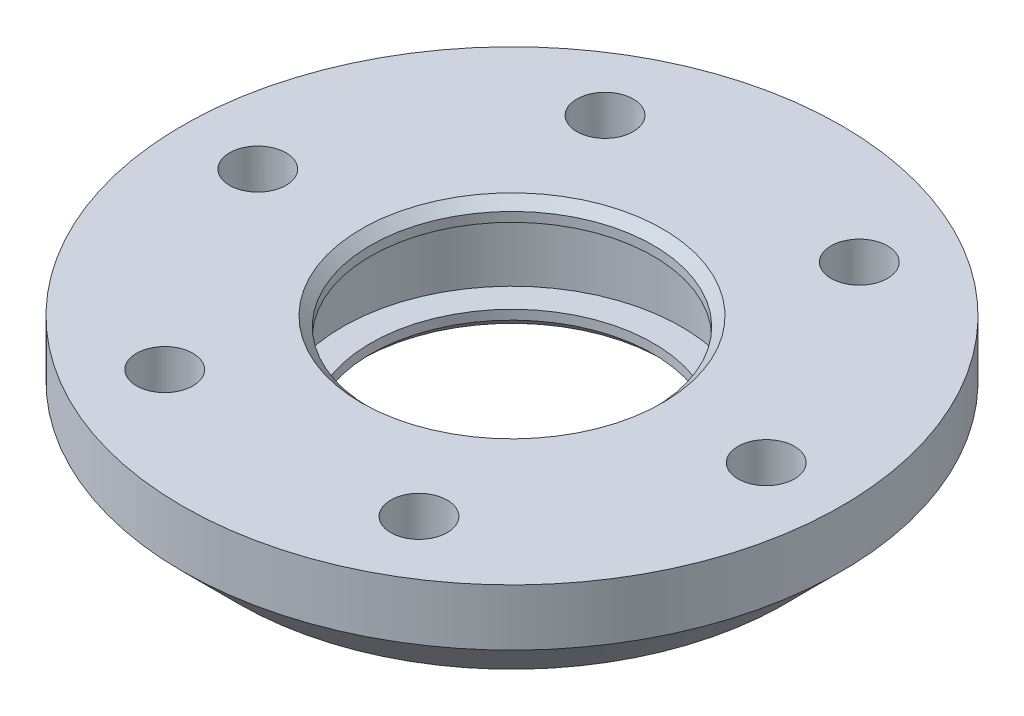
from build123d import *

# Parameters (mm, degrees)
SKETCH1_R           = 17.5
SKETCH1_R_2         = 1.5
SKETCH1_R_3         = 7.5
BOSS_EXTRUDE1_DEPTH = 3
SKETCH2_R           = 9
CUT_EXTRUDE1_DEPTH  = 2
SKETCH3_R           = 15
SKETCH3_R_2         = 12
BOSS_EXTRUDE2_DEPTH = 1.5
CHAMFER1_SIZE       = 0.5
CHAMFER2_SIZE       = 3


with BuildPart() as part:
    # Sketch1 → Boss-Extrude1 (new, symmetric)
    with BuildSketch(Plane(origin=(0, 0, 0), x_dir=(1, 0, 0), z_dir=(0, 1, 0))):
        Circle(SKETCH1_R)
        with Locations((13.5, 0)):
            Circle(SKETCH1_R_2, mode=Mode.SUBTRACT)
        with Locations((6.75, -11.691342951)):
            Circle(SKETCH1_R_2, mode=Mode.SUBTRACT)
        with Locations((-6.75, -11.691342951)):
            Circle(SKETCH1_R_2, mode=Mode.SUBTRACT)
        with Locations((-13.5, 0)):
            Circle(SKETCH1_R_2, mode=Mode.SUBTRACT)
        with Locations((-6.75, 11.691342951)):
            Circle(SKETCH1_R_2, mode=Mode.SUBTRACT)
        with Locations((6.75, 11.691342951)):
            Circle(SKETCH1_R_2, mode=Mode.SUBTRACT)
        Circle(SKETCH1_R_3, mode=Mode.SUBTRACT)
    extrude(amount=BOSS_EXTRUDE1_DEPTH, both=True)

    # Sketch2 → Cut-Extrude1 (cut, symmetric)
    with BuildSketch(Plane(origin=(0, 0, 0), x_dir=(1, 0, 0), z_dir=(0, 1, 0))):
        Circle(SKETCH2_R)
    extrude(amount=CUT_EXTRUDE1_DEPTH, both=True, mode=Mode.SUBTRACT)

    # Sketch3 → Boss-Extrude2 (add)
    with BuildSketch(Plane.XZ.offset(3)):
        Circle(SKETCH3_R)
        Circle(SKETCH3_R_2, mode=Mode.SUBTRACT)
    extrude(amount=-BOSS_EXTRUDE2_DEPTH)

    # Chamfer1
    chamfer1_edges = [part.edges().sort_by_distance(p)[0] for p in [
        (-7.5, -3, 0),
        (-7.5, 3, 0),
    ]]
    chamfer(chamfer1_edges, length=CHAMFER1_SIZE)

    # Chamfer2
    chamfer2_edges = [part.edges().sort_by_distance(p)[0] for p in [
        (-17.5, -3, 0),
    ]]
    chamfer(chamfer2_edges, length=CHAMFER2_SIZE)


solid = part.part
